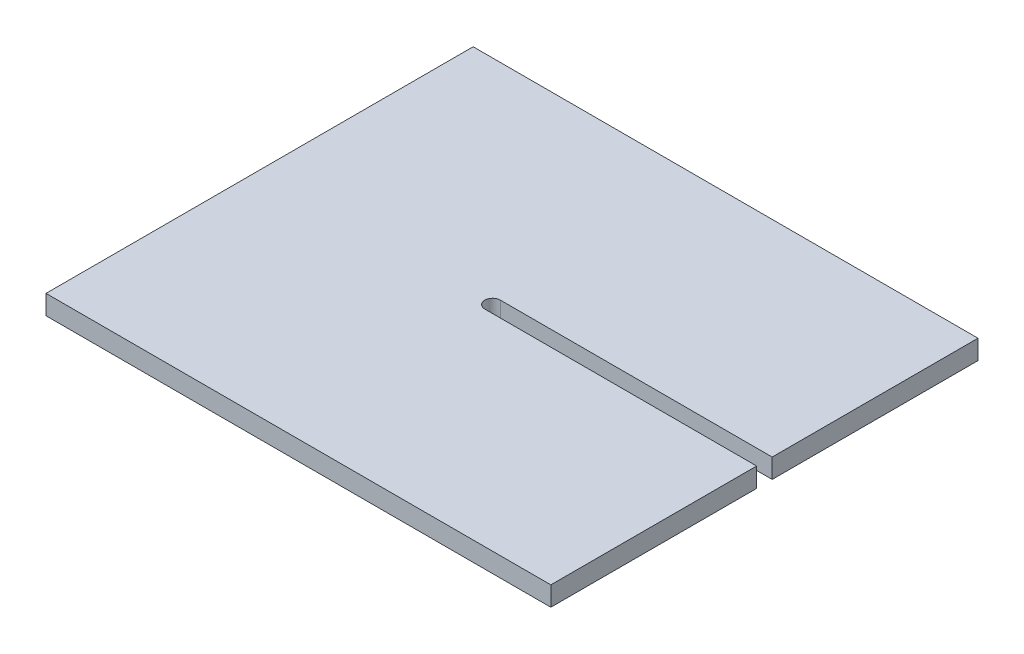
from build123d import *

# Parameters (mm, degrees)
SKETCH1_W           = 69.85
SKETCH1_H           = 3.175
BOSS_EXTRUDE2_DEPTH = 82.55
CUT_EXTRUDE1_DEPTH  = 94.674629983


with BuildPart() as part:
    # Sketch1 → Boss-Extrude2 (new body)
    with BuildSketch(Plane(origin=(0, 0, 0), x_dir=(0, 0, -1), z_dir=(1, 0, 0))):
        with Locations((-9.237803099, -7.653615186)):
            Rectangle(SKETCH1_W, SKETCH1_H)
    extrude(amount=BOSS_EXTRUDE2_DEPTH)

    # Sketch2 → Cut-Extrude1 (cut, through all)
    with BuildSketch(Plane(origin=(0, -6.066115186, 0), x_dir=(1, 0, 0), z_dir=(0, 1, 0))):
        with BuildLine():
            Line((38.1, -7.967803099), (82.55, -7.967803099))
            Line((82.55, -7.967803099), (82.55, -10.507803099))
            Line((82.55, -10.507803099), (38.1, -10.507803099))
            ThreePointArc((38.1, -10.507803099), (36.83, -9.237803099), (38.1, -7.967803099))
        make_face()
    extrude(amount=-CUT_EXTRUDE1_DEPTH, mode=Mode.SUBTRACT)


solid = part.part
